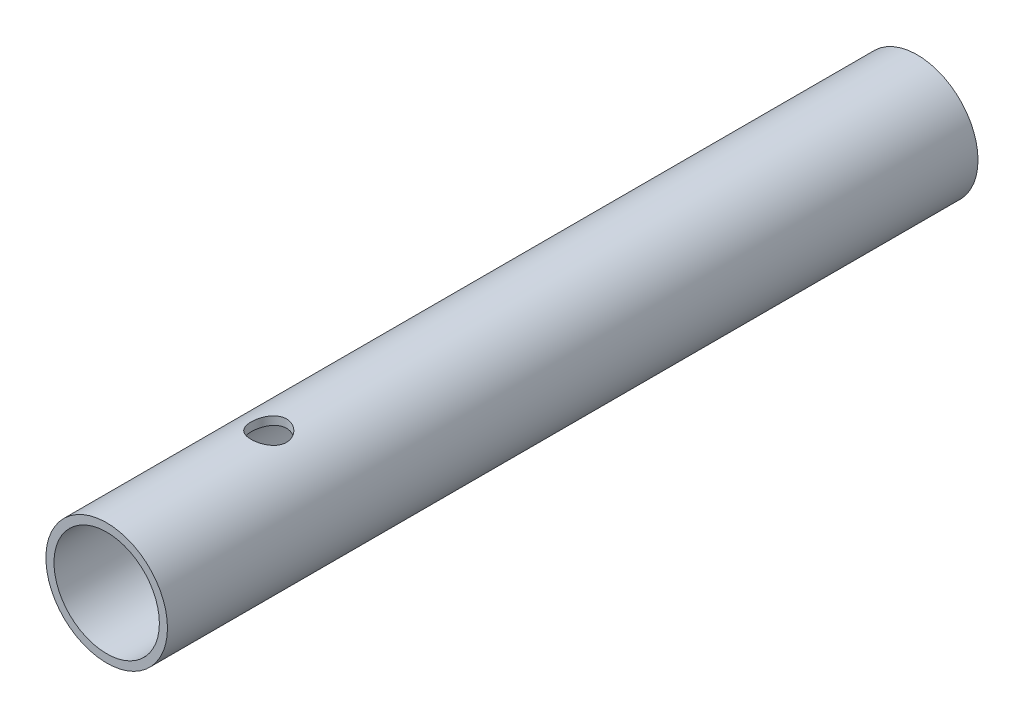
from build123d import *

# Parameters (mm, degrees)
SKETCH1_R           = 19.05
SKETCH1_R_2         = 16.51
EXTRUDE_THIN1_DEPTH = 254
SKETCH2_R           = 5.55625
CUT_EXTRUDE1_DEPTH  = 256.424754086


with BuildPart() as part:
    # Sketch1 → Extrude-Thin1 (new body)
    with BuildSketch(Plane.XY):
        Circle(SKETCH1_R)
        Circle(SKETCH1_R_2, mode=Mode.SUBTRACT)
    extrude(amount=-EXTRUDE_THIN1_DEPTH)

    # Sketch2 → Cut-Extrude1 (cut, through all)
    with BuildSketch(Plane(origin=(0, 0, 0), x_dir=(1, 0, 0), z_dir=(0, 1, 0))):
        with Locations((0, 50.8)):
            Circle(SKETCH2_R)
    extrude(amount=CUT_EXTRUDE1_DEPTH, mode=Mode.SUBTRACT)


solid = part.part
